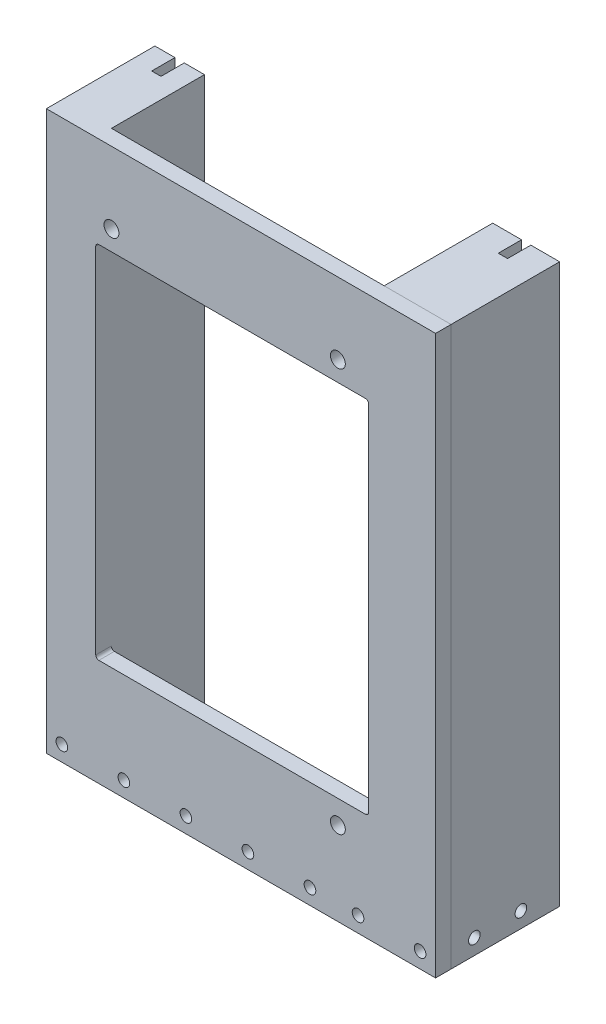
from build123d import *

# Parameters (mm, degrees)
BOSS_EXTRUDE1_DEPTH                = 0.5
SKETCH4_3_W                        = 2.157759448
SKETCH4_3_H                        = 18
BOSS_EXTRUDE2_DEPTH                = 3.5
BOSS_EXTRUDE3_DEPTH                = 3
FILLET1_R                          = 0.1
SKETCH26_W                         = 0.24
SKETCH26_H                         = 4
SKETCH28_W                         = 0.3
SKETCH28_H                         = 0.75
CUT_EXTRUDE1_DEPTH                 = 18
M0_5X0_125_TAPPED_HOLE1_AT_2_COUNT = 2
M0_5X0_125_TAPPED_HOLE1_AT_2_PITCH = 11.549997101
M0_5X0_125_TAPPED_HOLE1_AT_3_COUNT = 2
M0_5X0_125_TAPPED_HOLE1_AT_3_PITCH = 2
M0_5X0_125_TAPPED_HOLE1_AT_4_COUNT = 2
M0_5X0_125_TAPPED_HOLE1_AT_4_PITCH = 4
M0_5X0_125_TAPPED_HOLE1_AT_5_COUNT = 2
M0_5X0_125_TAPPED_HOLE1_AT_5_PITCH = 6
M0_5X0_125_TAPPED_HOLE1_AT_6_COUNT = 2
M0_5X0_125_TAPPED_HOLE1_AT_6_PITCH = 8
M0_5X0_125_TAPPED_HOLE1_AT_7_COUNT = 2
M0_5X0_125_TAPPED_HOLE1_AT_7_PITCH = 9.549997101
M0_5X0_125_TAPPED_HOLE2_AT_2_COUNT = 2
M0_5X0_125_TAPPED_HOLE2_AT_2_PITCH = 1.5
MIRROR9_START                      = -6
MIRROR9_OUTLINE_R                  = 0.1875
MIRROR9_DEPTH                      = 1.867813005


with BuildPart() as part:
    # Sketch4 → Boss-Extrude1 (new body)
    with BuildSketch(Plane(origin=(5.549975664, -0.767698462, 0), x_dir=(1, 0, 0), z_dir=(0, 0, 1))):
        Polygon((-10.942216218, -8.482301538), (1.607783784, -8.482301538), (1.607783784, 9.517698462), (-10.942111801, 9.517698462), align=None)
        Polygon((-0.549975664, -5.040773631), (-9.349975664, -5.040773631), (-9.349975664, 6.563333727), (-9.349962677, 6.569879134), (-0.549975664, 6.569879134), align=None, mode=Mode.SUBTRACT)
    extrude(amount=BOSS_EXTRUDE1_DEPTH)

    # Sketch4<5> → Boss-Extrude3 (add)
    with BuildSketch(Plane(origin=(5.549975664, -0.767698462, 0), x_dir=(1, 0, 0), z_dir=(0, 0, 1))):
        Polygon((-10.942216218, -8.482301538), (-9.349975664, -8.482301538), (-9.349975664, 6.563333727), (-9.34411366, 9.517698462), (-10.942111801, 9.517698462), align=None)
    extrude(amount=-BOSS_EXTRUDE3_DEPTH)

    # Fillet1
    # the kernel refuses this fillet: 0.1 mm, written as the material it adds along each edge
    with BuildSketch(Plane(origin=(-3.8, -5.808472093, 0), x_dir=(1, 0, 0), z_dir=(0, 0, 1)), Plane(origin=(5, -5.808472093, 0), x_dir=(0, 1, 0), z_dir=(0, 0, 1)), Plane(origin=(5, 5.802180672, 0), x_dir=(-1, 0, 0), z_dir=(0, 0, 1))) as fillet1_piece_1:
        with BuildLine():
            CenterArc((FILLET1_R, FILLET1_R), FILLET1_R, 180, 90)
            Line((0, FILLET1_R), (0, 0))
            Line((0, 0), (FILLET1_R, 0))
        make_face()
    extrude(amount=0.5)
    with BuildSketch(Plane(origin=(-3.799987013, 5.802180672, 0), x_dir=(-0.0001298729448490843, -0.9999999915665091, 0), z_dir=(0, 0, 1))) as fillet1_piece_2:
        with BuildLine():
            CenterArc((0.099987014, 0.099999999), FILLET1_R, 180.007441172, 90)
            Line((-1.2986e-05, 0.099987012), (-0.010012986, 0.099985713))
            Line((-0.010012986, 0.099985713), (-0.01, -1.299e-06))
            Line((-0.01, -1.299e-06), (-1.8543e-05, -0.009999983))
            ThreePointArc((-1.8543e-05, -0.009999983), (0.006546707, -0.010012137), (0.1000013, -0.01))
            Line((0.1000013, -0.01), (0.100000001, 0))
        make_face()
    extrude(amount=0.5)

    # Sketch26 → M0.6x0.15 Tapped Hole - pcb mount (revolve, cut)
    with BuildSketch(Plane(origin=(-3.293086815, 6.441527579, 0.5), x_dir=(0, -1, 0), z_dir=(1, 0, 0))):
        with Locations((0.12, 2)):
            Rectangle(SKETCH26_W, SKETCH26_H)
    revolve(axis=Axis((-3.293086815, 6.441527579, 6.85), (0, 0, -1)), mode=Mode.SUBTRACT)


with BuildPart() as body_2:
    # Sketch4<3> → Boss-Extrude2 (new body)
    with BuildSketch(Plane(origin=(5.549975664, -0.767698462, 0), x_dir=(1, 0, 0), z_dir=(0, 0, 1))):
        with Locations((0.52890406, 0.517698462)):
            Rectangle(SKETCH4_3_W, SKETCH4_3_H)
    extrude(amount=-BOSS_EXTRUDE2_DEPTH)


with BuildPart() as cut_extrude1_tool:
    # Sketch28 → Cut-Extrude1 (new body)
    with BuildSketch(Plane(origin=(0, -9.25, 0), x_dir=(-1, 0, 0), z_dir=(0, -1, 0))):
        with Locations((4.596120277, 2.625)):
            Rectangle(SKETCH28_W, SKETCH28_H)
        with Locations((-6.078879724, 3.125)):
            Rectangle(SKETCH28_W, SKETCH28_H)
    extrude(amount=-CUT_EXTRUDE1_DEPTH)


with BuildPart() as part_1:
    add(part.part)

    # Cut-Extrude1: cut by cut_extrude1_tool
    add(cut_extrude1_tool.part, mode=Mode.SUBTRACT)

    # Sketch30 → M0.5x0.125 Tapped Hole1 (revolve, cut)
    with BuildSketch(Plane(origin=(-4.892237653, -8.75, 0.5), x_dir=(0, -1, 0), z_dir=(1, 0, 0))):
        Polygon((0, 0), (0, 0.862661366), (0.1875, 0.75), (0.1875, 0), align=None)
    m0_5x0_125_tapped_hole1 = revolve(axis=Axis((-4.892237653, -8.75, 6.85), (0, 0, -1)), mode=Mode.SUBTRACT)


with BuildPart() as body_2_1:
    add(body_2.part)

    # Cut-Extrude1: cut by cut_extrude1_tool
    add(cut_extrude1_tool.part, mode=Mode.SUBTRACT)


with BuildPart() as m0_5x0_125_tapped_hole1_at_2_tool:
    # M0.5x0.125 Tapped Hole1 at 2: M0.5x0.125 Tapped Hole1 ×2
    with Locations(*[(i * M0_5X0_125_TAPPED_HOLE1_AT_2_PITCH, 0, 0) for i in range(1, M0_5X0_125_TAPPED_HOLE1_AT_2_COUNT)]):
        add(m0_5x0_125_tapped_hole1)


with BuildPart() as part_2:
    add(part_1.part)

    # M0.5x0.125 Tapped Hole1 at 2: cut by m0_5x0_125_tapped_hole1_at_2_tool
    add(m0_5x0_125_tapped_hole1_at_2_tool.part, mode=Mode.SUBTRACT)

    # M0.5x0.125 Tapped Hole1 at 3: M0.5x0.125 Tapped Hole1 ×2
    with Locations(*[(i * M0_5X0_125_TAPPED_HOLE1_AT_3_PITCH, 0, 0) for i in range(1, M0_5X0_125_TAPPED_HOLE1_AT_3_COUNT)]):
        add(m0_5x0_125_tapped_hole1, mode=Mode.SUBTRACT)

    # M0.5x0.125 Tapped Hole1 at 4: M0.5x0.125 Tapped Hole1 ×2
    with Locations(*[(i * M0_5X0_125_TAPPED_HOLE1_AT_4_PITCH, 0, 0) for i in range(1, M0_5X0_125_TAPPED_HOLE1_AT_4_COUNT)]):
        add(m0_5x0_125_tapped_hole1, mode=Mode.SUBTRACT)

    # M0.5x0.125 Tapped Hole1 at 5: M0.5x0.125 Tapped Hole1 ×2
    with Locations(*[(i * M0_5X0_125_TAPPED_HOLE1_AT_5_PITCH, 0, 0) for i in range(1, M0_5X0_125_TAPPED_HOLE1_AT_5_COUNT)]):
        add(m0_5x0_125_tapped_hole1, mode=Mode.SUBTRACT)

    # M0.5x0.125 Tapped Hole1 at 6: M0.5x0.125 Tapped Hole1 ×2
    with Locations(*[(i * M0_5X0_125_TAPPED_HOLE1_AT_6_PITCH, 0, 0) for i in range(1, M0_5X0_125_TAPPED_HOLE1_AT_6_COUNT)]):
        add(m0_5x0_125_tapped_hole1, mode=Mode.SUBTRACT)

    # M0.5x0.125 Tapped Hole1 at 7: M0.5x0.125 Tapped Hole1 ×2
    with Locations(*[(i * M0_5X0_125_TAPPED_HOLE1_AT_7_PITCH, 0, 0) for i in range(1, M0_5X0_125_TAPPED_HOLE1_AT_7_COUNT)]):
        add(m0_5x0_125_tapped_hole1, mode=Mode.SUBTRACT)

    # Mirror9: read off the stored shape, not the designer's step
    # Mirror9 outline → Mirror9 (cut)
    with BuildSketch(Plane(origin=(0, 0, 0), x_dir=(5.800925593088129e-06, 0.9999999999831747, 0), z_dir=(0.9999999999831748, -5.8009255930881285e-06, 0)).offset(MIRROR9_START)):
        with Locations((-8.749630019, -0.75)):
            Circle(MIRROR9_OUTLINE_R)
        with Locations((-8.749630019, -2.25)):
            Circle(MIRROR9_OUTLINE_R)
    extrude(amount=MIRROR9_DEPTH, mode=Mode.SUBTRACT)

    # Mirror9 2 outline → Mirror9 2 (revolve, cut)
    with BuildSketch(Plane(origin=(-5.0756e-05, -8.749630019, -0.75), x_dir=(5.800925593088129e-06, 0.9999999999831747, 0), z_dir=(0, 0, -1))):
        Polygon((0.1875, -4.132186895), (0, -4.019525529), (0, -4.132186995), align=None)
    revolve(axis=Axis((-5.0756e-05, -8.749630019, -0.75), (0.9999999999831749, -5.800925593088131e-06, 0)), mode=Mode.SUBTRACT)

    # Mirror9 3 outline → Mirror9 3 (revolve, cut)
    with BuildSketch(Plane(origin=(-5.0756e-05, -8.749630019, -2.25), x_dir=(5.800925593088129e-06, 0.9999999999831747, 0), z_dir=(0, 0, -1))):
        Polygon((0.1875, -4.132186895), (0, -4.019525529), (0, -4.132186995), align=None)
    revolve(axis=Axis((-5.0756e-05, -8.749630019, -2.25), (0.9999999999831749, -5.800925593088131e-06, 0)), mode=Mode.SUBTRACT)

    # Sketch45 → M0.6x0.15 Tapped Hole1 (revolve, cut)
    with BuildSketch(Plane(origin=(4.006913198, 6.441527579, 0.5), x_dir=(0, -1, 0), z_dir=(1, 0, 0))):
        Polygon((0, 0), (0, 1.144206549), (0.24, 1), (0.24, 0), align=None)
    revolve(axis=Axis((4.006913198, 6.441527579, 6.85), (0, 0, -1)), mode=Mode.SUBTRACT)

    # Sketch50 → M0.6x0.15 Tapped Hole2 (revolve, cut)
    with BuildSketch(Plane(origin=(4.006913151, -6.558470788, 0.5), x_dir=(0, -1, 0), z_dir=(1, 0, 0))):
        Polygon((0, 0), (0, 1.794206549), (0.24, 1.65), (0.24, 0), align=None)
    revolve(axis=Axis((4.006913151, -6.558470788, 6.85), (0, 0, -1)), mode=Mode.SUBTRACT)


with BuildPart() as body_2_2:
    add(body_2_1.part)

    # M0.5x0.125 Tapped Hole1 at 2: cut by m0_5x0_125_tapped_hole1_at_2_tool
    add(m0_5x0_125_tapped_hole1_at_2_tool.part, mode=Mode.SUBTRACT)

    # Sketch32 → M0.5x0.125 Tapped Hole2 (revolve, cut)
    with BuildSketch(Plane(origin=(7.157759448, -8.74963514, -0.75), x_dir=(0, 0, -1), z_dir=(0, 1, 0))):
        Polygon((0, 0), (0, 1.372661366), (0.1875, 1.26), (0.1875, 0), align=None)
    m0_5x0_125_tapped_hole2 = revolve(axis=Axis((13.507759448, -8.74963514, -0.75), (-1, 0, 0)), mode=Mode.SUBTRACT)

    # M0.5x0.125 Tapped Hole2 at 2: M0.5x0.125 Tapped Hole2 ×2
    with Locations(*[(0, 0, -i * M0_5X0_125_TAPPED_HOLE2_AT_2_PITCH) for i in range(1, M0_5X0_125_TAPPED_HOLE2_AT_2_COUNT)]):
        add(m0_5x0_125_tapped_hole2, mode=Mode.SUBTRACT)


solid = Compound([part_2.part, body_2_2.part])
